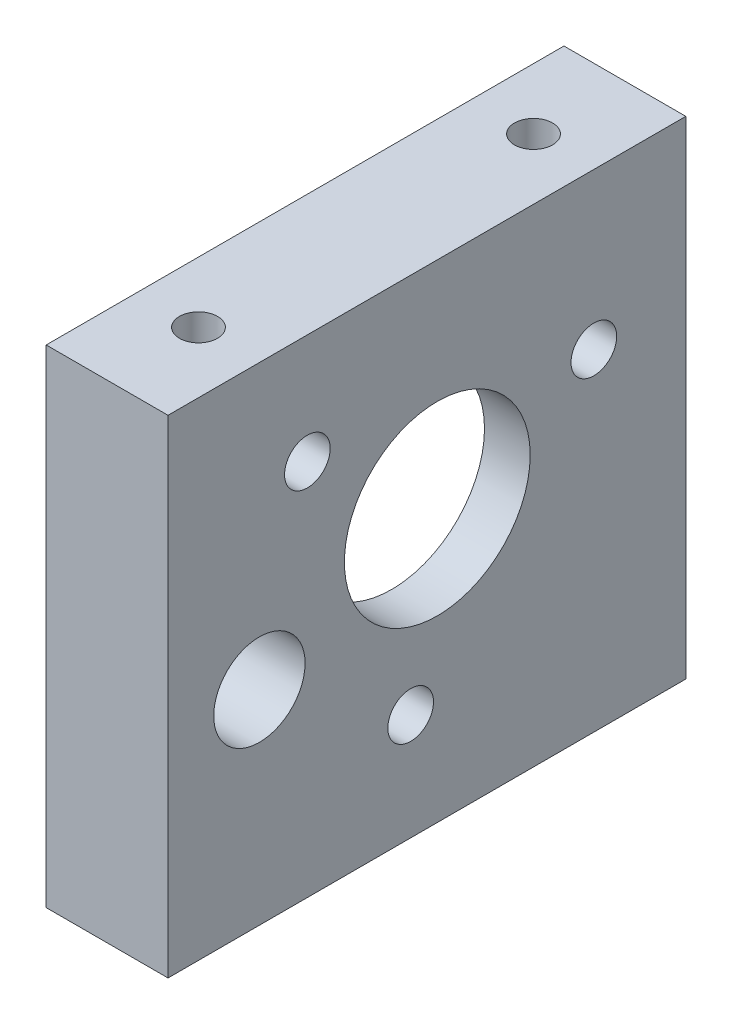
from build123d import *

# Parameters (mm, degrees)
SKETCH1_W                       = 34
SKETCH1_H                       = 32
BOSS_EXTRUDE1_DEPTH             = 8
CUT_EXTRUDE1_REACH              = 49.371
SKETCH2_R                       = 6.1
SKETCH2_R_2                     = 3
SKETCH2_R_3                     = 1.5
CIRPATTERN1_OUTLINE_R           = 1.5
CIRPATTERN1_DEPTH               = 8
CUT_EXTRUDE2_DEPTH              = 5
TAP_DRILL_FOR_M3X0_5_TAP1_D     = 2.5
TAP_DRILL_FOR_M3X0_5_TAP1_DEPTH = 3
TAP_DRILL_FOR_M3X0_5_TAP1_TIP   = 0.751075774
TAP_DRILL_FOR_M3X0_5_TAP2_D     = 2.5
TAP_DRILL_FOR_M3X0_5_TAP2_DEPTH = 3
TAP_DRILL_FOR_M3X0_5_TAP2_TIP   = 0.751075774


# Read off the part's stored shape, not the designer's step: CirPattern1
with BuildPart() as part:
    # Sketch1 → Boss-Extrude1 (new body)
    with BuildSketch(Plane(origin=(0, 0, 0), x_dir=(0, 0, -1), z_dir=(1, 0, 0))):
        with Locations((17, 16)):
            Rectangle(SKETCH1_W, SKETCH1_H)
    extrude(amount=BOSS_EXTRUDE1_DEPTH)

    # Sketch2 → Cut-Extrude1 (cut, up to next)
    with BuildSketch(Plane(origin=(8, 0, 0), x_dir=(0, 0, -1), z_dir=(1, 0, 0)), mode=Mode.PRIVATE) as cut_extrude1_sk1:
        with Locations((17.681074437, 17.85)):
            Circle(SKETCH2_R)
    cut_extrude1_tool1 = extrude(cut_extrude1_sk1.sketch, amount=-CUT_EXTRUDE1_REACH, mode=Mode.PRIVATE) & part.part
    # Sketch2 → Cut-Extrude1 (cut, up to next)
    with BuildSketch(Plane(origin=(8, 0, 0), x_dir=(0, 0, -1), z_dir=(1, 0, 0)), mode=Mode.PRIVATE) as cut_extrude1_sk2:
        with Locations((6, 13.4)):
            Circle(SKETCH2_R_2)
    cut_extrude1_tool2 = extrude(cut_extrude1_sk2.sketch, amount=-CUT_EXTRUDE1_REACH, mode=Mode.PRIVATE) & part.part
    # Sketch2 → Cut-Extrude1 (cut, up to next)
    with BuildSketch(Plane(origin=(8, 0, 0), x_dir=(0, 0, -1), z_dir=(1, 0, 0)), mode=Mode.PRIVATE) as cut_extrude1_sk3:
        with Locations((27.960419941, 21.766)):
            Circle(SKETCH2_R_3)
    cut_extrude1_tool3 = extrude(cut_extrude1_sk3.sketch, amount=-CUT_EXTRUDE1_REACH, mode=Mode.PRIVATE) & part.part
    add(cut_extrude1_tool1.solids().sort_by_distance((8, 17.85, -17.681074))[0], mode=Mode.SUBTRACT)
    add(cut_extrude1_tool2.solids().sort_by_distance((8, 13.4, -6))[0], mode=Mode.SUBTRACT)
    add(cut_extrude1_tool3.solids().sort_by_distance((8, 21.766, -27.96042))[0], mode=Mode.SUBTRACT)

    # CirPattern1 outline → CirPattern1 (cut)
    with BuildSketch(Plane.YZ):
        with Locations((6.989825659, -15.932757166)):
            Circle(CIRPATTERN1_OUTLINE_R)
        with Locations((24.794174341, -9.150046203)):
            Circle(CIRPATTERN1_OUTLINE_R)
    extrude(amount=CIRPATTERN1_DEPTH, mode=Mode.SUBTRACT)

    # Sketch3 → Cut-Extrude2 (cut)
    with BuildSketch(Plane(origin=(0, 0, 0), x_dir=(0, 0, -1), z_dir=(1, 0, 0))):
        with BuildLine():
            Line((32, 25), (32, 7))
            ThreePointArc((32, 7), (31.121320344, 4.878679656), (29, 4))
            Line((29, 4), (15, 4))
            ThreePointArc((15, 4), (12.878679656, 4.878679656), (12, 7))
            Line((12, 7), (12, 13.4))
            ThreePointArc((12, 13.4), (10.898979486, 16.864101615), (8, 19.056854249))
            ThreePointArc((8, 19.056854249), (6.550510257, 20.153230567), (6, 21.885281374))
            Line((6, 21.885281374), (6, 25))
            ThreePointArc((6, 25), (6.878679656, 27.121320344), (9, 28))
            Line((9, 28), (29, 28))
            ThreePointArc((29, 28), (31.121320344, 27.121320344), (32, 25))
        make_face()
    extrude(amount=CUT_EXTRUDE2_DEPTH, mode=Mode.SUBTRACT)

    # Tap Drill for M3x0.5 Tap1
    with Locations(Plane(origin=(0, 32, 0), x_dir=(-1, 0, 0), z_dir=(0, 1, 0))):
        with Locations((-4, -6), (-4, -28)):
            Hole(TAP_DRILL_FOR_M3X0_5_TAP1_D / 2, depth=TAP_DRILL_FOR_M3X0_5_TAP1_DEPTH)
            with Locations((0, 0, -(TAP_DRILL_FOR_M3X0_5_TAP1_DEPTH + TAP_DRILL_FOR_M3X0_5_TAP1_TIP / 2))):  # 118° drill point
                Cone(0, TAP_DRILL_FOR_M3X0_5_TAP1_D / 2, TAP_DRILL_FOR_M3X0_5_TAP1_TIP, mode=Mode.SUBTRACT)

    # Tap Drill for M3x0.5 Tap2
    with Locations(Plane.XZ):
        with Locations((4, -6), (4, -28)):
            Hole(TAP_DRILL_FOR_M3X0_5_TAP2_D / 2, depth=TAP_DRILL_FOR_M3X0_5_TAP2_DEPTH)
            with Locations((0, 0, -(TAP_DRILL_FOR_M3X0_5_TAP2_DEPTH + TAP_DRILL_FOR_M3X0_5_TAP2_TIP / 2))):  # 118° drill point
                Cone(0, TAP_DRILL_FOR_M3X0_5_TAP2_D / 2, TAP_DRILL_FOR_M3X0_5_TAP2_TIP, mode=Mode.SUBTRACT)


solid = part.part
